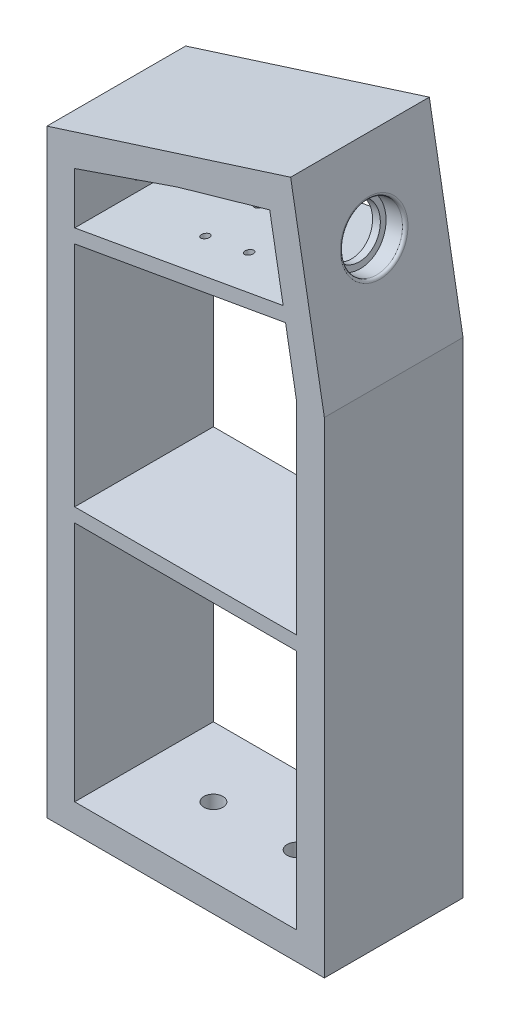
from build123d import *

# Parameters (mm, degrees)
BOSS_EXTRUDE1_DEPTH = 50
SKETCH4_R           = 11.025
CUT_EXTRUDE1_DEPTH  = 7
SKETCH5_R           = 9
CUT_EXTRUDE2_DEPTH  = 7
BOSS_EXTRUDE2_DEPTH = 50
SKETCH8_R           = 5
CUT_EXTRUDE3_DEPTH  = 10
CUT_EXTRUDE4_REACH  = 213.444
SKETCH9_R           = 1.485
SKETCH10_R          = 3.425
CUT_EXTRUDE5_DEPTH  = 10
SKETCH11_W          = 80
SKETCH11_H          = 5
BOSS_EXTRUDE3_DEPTH = 50
FILLET1_R           = 1


with BuildPart() as part:
    # Sketch2 → Boss-Extrude1 (new body)
    with BuildSketch(Plane.XY):
        Polygon((-40.869025982, 215.979452737), (-40.869025982, 0), (59.130974018, 0), (59.130974018, 175), (46.975601581, 243.936542711), align=None)
        Polygon((0, 10), (49.130974018, 10), (49.130974018, 87.5), (49.130974018, 175), (39.440396213, 229.957997724), (6.085967265, 220.428944505), (-30.869025982, 207.731789579), (-30.869025982, 107.989726368), (-30.869025982, 10), align=None, mode=Mode.SUBTRACT)
    extrude(amount=BOSS_EXTRUDE1_DEPTH)

    # Sketch4 → Cut-Extrude1 (cut)
    with BuildSketch(Plane(origin=(87.274719522, 15.388887785, 0), x_dir=(0, 0, -1), z_dir=(0.9848077530122079, 0.17364817766693136, 0))):
        with Locations((-25, 202.690370895)):
            Circle(SKETCH4_R)
    extrude(amount=-CUT_EXTRUDE1_DEPTH, mode=Mode.SUBTRACT)

    # Sketch5 → Cut-Extrude2 (cut)
    with BuildSketch(Plane(origin=(80.381065251, 14.173350542, 0), x_dir=(0, 0, -1), z_dir=(0.9848077530122079, 0.17364817766693136, 0))):
        with Locations((-25, 202.690370895)):
            Circle(SKETCH5_R)
    extrude(amount=-CUT_EXTRUDE2_DEPTH, mode=Mode.SUBTRACT)

    # Sketch7 → Boss-Extrude2 (add)
    with BuildSketch(Plane.XY.offset(50)):
        Polygon((44.278549366, 202.519467707), (45.146790254, 197.595428942), (-30.869025982, 184.191789579), (-30.869025982, 189.191789579), align=None)
    extrude(amount=-BOSS_EXTRUDE2_DEPTH)

    # Sketch8 → Cut-Extrude3 (cut)
    with BuildSketch(Plane.ZY.offset(40.869025982)):
        with Locations((25, 197.153858422)):
            Circle(SKETCH8_R)
    extrude(amount=-CUT_EXTRUDE3_DEPTH, mode=Mode.SUBTRACT)

    # Sketch9 → Cut-Extrude4 (cut, up to next)
    with BuildSketch(Plane(origin=(-32.429466164, 183.916641873, 0), x_dir=(0.9848077530122079, 0.17364817766693133, 0), z_dir=(0.17364817766693133, -0.9848077530122079, 0)), mode=Mode.PRIVATE) as cut_extrude4_sk1:
        with Locations((50.694512486, 15.4)):
            Circle(SKETCH9_R)
    cut_extrude4_tool1 = extrude(cut_extrude4_sk1.sketch, amount=-CUT_EXTRUDE4_REACH, mode=Mode.PRIVATE) & part.part
    # Sketch9 → Cut-Extrude4 (cut, up to next)
    with BuildSketch(Plane(origin=(-32.429466164, 183.916641873, 0), x_dir=(0.9848077530122079, 0.17364817766693133, 0), z_dir=(0.17364817766693133, -0.9848077530122079, 0)), mode=Mode.PRIVATE) as cut_extrude4_sk2:
        with Locations((50.694512486, 34.6)):
            Circle(SKETCH9_R)
    cut_extrude4_tool2 = extrude(cut_extrude4_sk2.sketch, amount=-CUT_EXTRUDE4_REACH, mode=Mode.PRIVATE) & part.part
    # Sketch9 → Cut-Extrude4 (cut, up to next)
    with BuildSketch(Plane(origin=(-32.429466164, 183.916641873, 0), x_dir=(0.9848077530122079, 0.17364817766693133, 0), z_dir=(0.17364817766693133, -0.9848077530122079, 0)), mode=Mode.PRIVATE) as cut_extrude4_sk3:
        with Locations((34.694512486, 34.6)):
            Circle(SKETCH9_R)
    cut_extrude4_tool3 = extrude(cut_extrude4_sk3.sketch, amount=-CUT_EXTRUDE4_REACH, mode=Mode.PRIVATE) & part.part
    # Sketch9 → Cut-Extrude4 (cut, up to next)
    with BuildSketch(Plane(origin=(-32.429466164, 183.916641873, 0), x_dir=(0.9848077530122079, 0.17364817766693133, 0), z_dir=(0.17364817766693133, -0.9848077530122079, 0)), mode=Mode.PRIVATE) as cut_extrude4_sk4:
        with Locations((34.694512486, 15.4)):
            Circle(SKETCH9_R)
    cut_extrude4_tool4 = extrude(cut_extrude4_sk4.sketch, amount=-CUT_EXTRUDE4_REACH, mode=Mode.PRIVATE) & part.part
    add(cut_extrude4_tool1.solids().sort_by_distance((17.494883, 192.719652, 15.4))[0], mode=Mode.SUBTRACT)
    add(cut_extrude4_tool2.solids().sort_by_distance((17.494883, 192.719652, 34.6))[0], mode=Mode.SUBTRACT)
    add(cut_extrude4_tool3.solids().sort_by_distance((1.737959, 189.941281, 34.6))[0], mode=Mode.SUBTRACT)
    add(cut_extrude4_tool4.solids().sort_by_distance((1.737959, 189.941281, 15.4))[0], mode=Mode.SUBTRACT)

    # Sketch10 → Cut-Extrude5 (cut)
    with BuildSketch(Plane(origin=(0, 10, 0), x_dir=(1, 0, 0), z_dir=(0, 1, 0))):
        with Locations((-5.851287133, -25)):
            Circle(SKETCH10_R)
        with Locations((24.130974018, -25)):
            Circle(SKETCH10_R)
    extrude(amount=-CUT_EXTRUDE5_DEPTH, mode=Mode.SUBTRACT)

    # Sketch11 → Boss-Extrude3 (add)
    with BuildSketch(Plane.XY.offset(50)):
        with Locations((9.130974018, 99.595894789)):
            Rectangle(SKETCH11_W, SKETCH11_H)
    extrude(amount=-BOSS_EXTRUDE3_DEPTH)

    # Fillet1
    fillet1_edges = [part.edges().sort_by_distance(p)[0] for p in [
        (52.077905985, 214.999936504, 36.025),
    ]]
    fillet(fillet1_edges, radius=FILLET1_R)


solid = part.part
